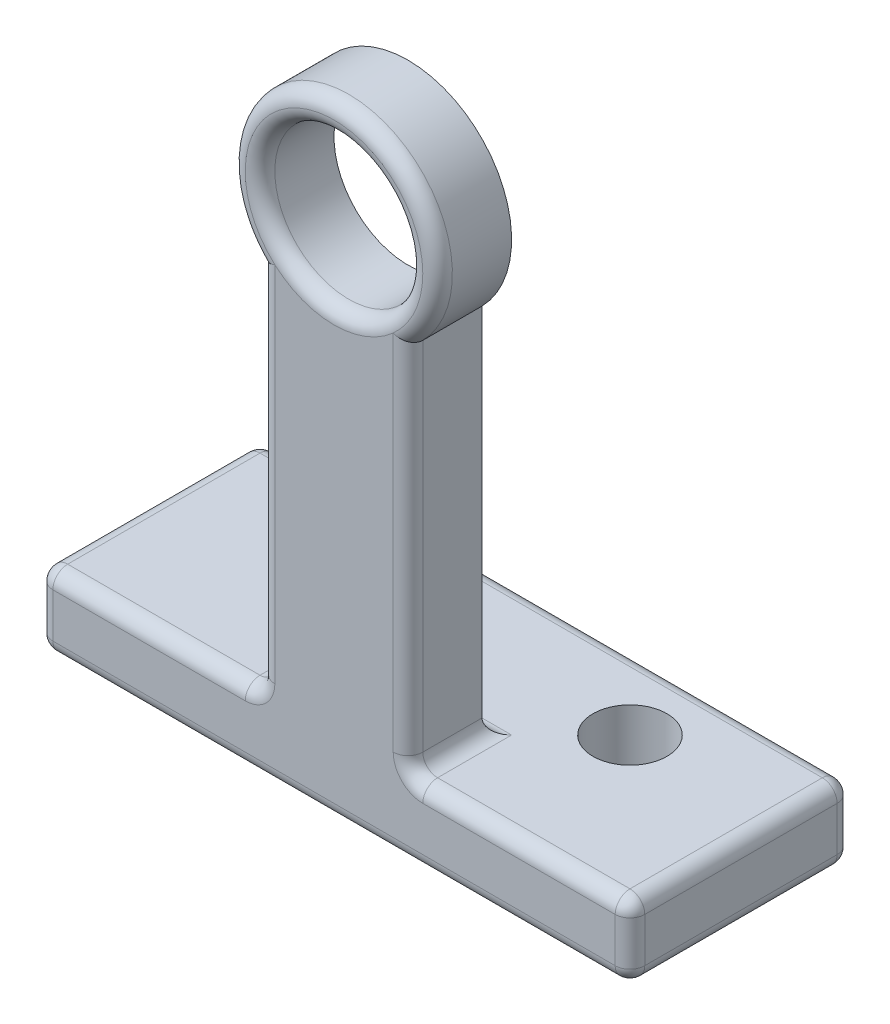
from build123d import *

# Parameters (mm, degrees)
SKETCH_1_R          = 5
EXTRUDE_1_DEPTH     = 5
EXTRUDE_2_DEPTH     = 10
FILLET_1_R          = 1
SKETCH_2_R          = 2.5
CUT_EXTRUDE_1_DEPTH = 10


with BuildPart() as part:
    # 草图1 → 凸台-拉伸1 (new body)
    with BuildSketch(Plane.XY):
        with BuildLine():
            Line((-20, 0), (20, 0))
            Line((20, 0), (20, 5))
            Line((20, 5), (5, 5))
            Line((5, 5), (5, 30.101020514))
            ThreePointArc((5, 30.101020514), (0, 42), (-5, 30.101020514))
            Line((-5, 30.101020514), (-5, 5))
            Line((-5, 5), (-20, 5))
            Line((-20, 5), (-20, 0))
        make_face()
        with Locations((0, 35)):
            Circle(SKETCH_1_R, mode=Mode.SUBTRACT)
    extrude(amount=EXTRUDE_1_DEPTH)

    # 草图1<3> → 凸台-拉伸2 (add)
    with BuildSketch(Plane.XY):
        Polygon((0, 5), (0, 0), (20, 0), (20, 5), (5, 5), align=None)
        Polygon((-20, 0), (0, 0), (0, 5), (-5, 5), (-20, 5), align=None)
    extrude(amount=-EXTRUDE_2_DEPTH)

    # 圆角1
    fillet_1_edges = [part.edges().sort_by_distance(p)[0] for p in [
        (-5, 17.550510257, 5),
        (-12.5, 5, 5),
        (5, 5, 2.5),
        (20, 5, -2.5),
        (20, 0, -2.5),
        (-20, 0, -2.5),
        (-20, 5, -2.5),
        (-5, 5, 2.5),
        (-20, 2.5, 5),
        (0, 0, 5),
        (0, 5, 0),
        (20, 2.5, 5),
        (0, 0, -10),
        (20, 2.5, -10),
        (-20, 2.5, -10),
        (0, 5, -10),
        (12.5, 5, 5),
        (-5, 35, 5),
        (5, 17.550510257, 5),
        (0, 42, 5),
    ]]
    fillet(fillet_1_edges, radius=FILLET_1_R - 0.0001)  # a hair under: the kernel refuses the full size

    # 草图2 → 切除-拉伸1 (cut)
    with BuildSketch(Plane(origin=(0, 5, 0), x_dir=(1, 0, 0), z_dir=(0, 1, 0))):
        with Locations(Location((-10, 5, 0), (0, 0, 270))):
            Circle(SKETCH_2_R)
        with Locations(Location((10, 5, 0), (0, 0, 270))):
            Circle(SKETCH_2_R)
    extrude(amount=-CUT_EXTRUDE_1_DEPTH, mode=Mode.SUBTRACT)


solid = part.part
